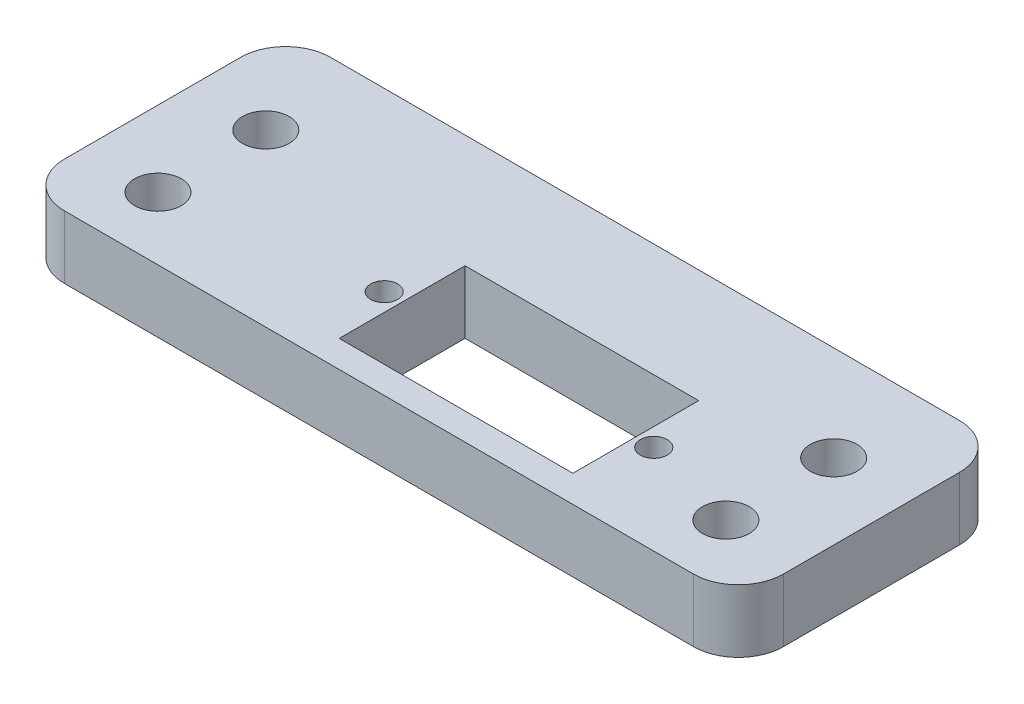
from build123d import *

# Parameters (mm, degrees)
SKETCH1_W             = 101.6
SKETCH1_H             = 37.592
INITIAL_EXTRUDE_DEPTH = 8.89
SKETCH2_R             = 3.302
SCREW_HOLES_DEPTH     = 109.695678681
SKETCH4_W             = 33.02
SKETCH4_H             = 17.78
SKETCH4_R             = 1.905
SERVO_RECT_HOLE_DEPTH = 109.695678681
FILLET1_R             = 6.35
SKETCH6_R             = 5.715
SCREW_HEAD_HOLE_DEPTH = 3.81


with BuildPart() as part:
    # Sketch1 → Initial Extrude (new body)
    with BuildSketch(Plane(origin=(0, 0, 0), x_dir=(1, 0, 0), z_dir=(0, 1, 0))):
        with Locations((50.8, 18.796)):
            Rectangle(SKETCH1_W, SKETCH1_H)
    extrude(amount=INITIAL_EXTRUDE_DEPTH)

    # Sketch2 → Screw Holes (cut, through all)
    with BuildSketch(Plane(origin=(0, 8.89, 0), x_dir=(1, 0, 0), z_dir=(0, 1, 0))):
        with Locations((10.668, 24.13)):
            Circle(SKETCH2_R)
        with Locations((10.668, 8.89)):
            Circle(SKETCH2_R)
        with Locations((90.932, 24.13)):
            Circle(SKETCH2_R)
        with Locations((90.932, 8.89)):
            Circle(SKETCH2_R)
    extrude(amount=-SCREW_HOLES_DEPTH, mode=Mode.SUBTRACT)

    # Sketch4 → Servo Rect Hole (cut, through all)
    with BuildSketch(Plane(origin=(0, 8.89, 0), x_dir=(1, 0, 0), z_dir=(0, 1, 0))):
        with Locations((57.88, 12.7)):
            Rectangle(SKETCH4_W, SKETCH4_H)
        with Locations((38.83, 12.7)):
            Circle(SKETCH4_R)
        with Locations((76.93, 12.7)):
            Circle(SKETCH4_R)
    extrude(amount=-SERVO_RECT_HOLE_DEPTH, mode=Mode.SUBTRACT)

    # Fillet1
    fillet1_edges = [part.edges().sort_by_distance(p)[0] for p in [
        (101.6, 4.445, -37.592),
        (101.6, 4.445, 0),
        (0, 4.445, 0),
        (0, 4.445, -37.592),
    ]]
    fillet(fillet1_edges, radius=FILLET1_R)

    # Sketch6 → Screw Head Hole (cut)
    with BuildSketch(Plane(origin=(0, 0, 0), x_dir=(-1, 0, 0), z_dir=(0, -1, 0))):
        with Locations((-10.668, 8.89)):
            Circle(SKETCH6_R)
        with Locations((-10.668, 24.13)):
            Circle(SKETCH6_R)
        with Locations((-90.932, 24.13)):
            Circle(SKETCH6_R)
        with Locations((-90.932, 8.89)):
            Circle(SKETCH6_R)
    extrude(amount=-SCREW_HEAD_HOLE_DEPTH, mode=Mode.SUBTRACT)


solid = part.part
